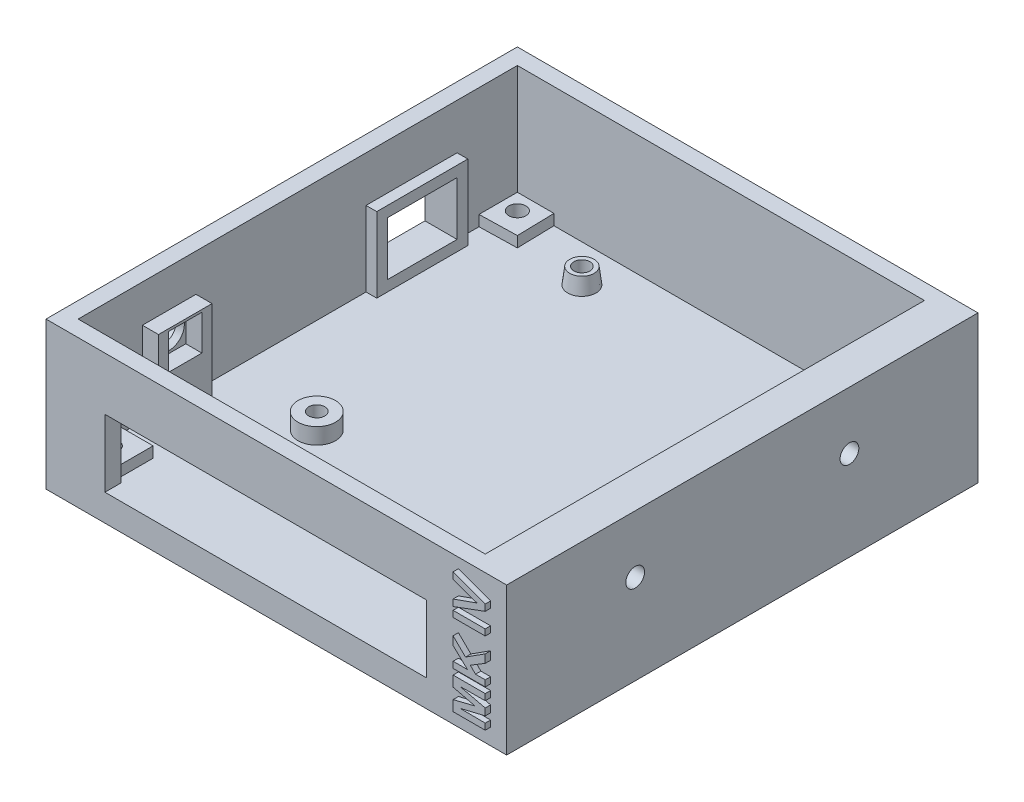
from build123d import *

# Parameters (mm, degrees)
SKETCH1_W            = 82
SKETCH1_H            = 88
BOSS_EXTRUDE1_DEPTH  = 5
SKETCH2_W            = 82
SKETCH2_H            = 88
SKETCH2_W_2          = 76
SKETCH2_H_2          = 82
BOSS_EXTRUDE2_DEPTH  = 22.5
SKETCH_1_R           = 3.5
SKETCH_1_R_2         = 1.5
BOSS_EXTRUDE3_DEPTH  = 3
SKETCH4_W            = 13
SKETCH4_H            = 12
CUT_EXTRUDE1_DEPTH   = 3
SKETCH7_R            = 1.6
CUT_EXTRUDE3_DEPTH   = 67.130552697
CUT_EXTRUDE4_DEPTH   = 3.5
SKETCH10_W           = 17
SKETCH10_H           = 16
SKETCH10_W_2         = 13
SKETCH10_H_2         = 12
BOSS_EXTRUDE6_DEPTH  = 2
CHAMFER1_SIZE        = 10
CHAMFER1_SIZE_2      = 1.227845609
SKETCH11_R           = 1.5
CUT_EXTRUDE5_DEPTH   = 65.212537717
SKETCH12_W           = 60
SKETCH12_H           = 12.6
CUT_EXTRUDE6_DEPTH   = 3
SKETCH13_R           = 1.75
CUT_EXTRUDE7_DEPTH   = 3
BOSS_EXTRUDE7_START  = 4
SKETCH14_W           = 88
SKETCH14_H           = 27.5
SKETCH14_R           = 1.75
BOSS_EXTRUDE7_DEPTH  = 4
SKETCH15_R           = 3.75
CUT_EXTRUDE8_DEPTH   = 3
CUT_EXTRUDE9_REACH   = 102.44
SKETCH16_R           = 2.25
SKETCH17_W           = 10
SKETCH17_H           = 15.5
SKETCH17_W_2         = 6.2
SKETCH17_H_2         = 6.6
BOSS_EXTRUDE8_DEPTH  = 3
CHAMFER2_SIZE        = 1
CHAMFER2_SIZE2       = 0.577350269
SKETCH20_R           = 5
SKETCH20_R_2         = 3
BOSS_EXTRUDE10_DEPTH = 1
FILLET3_R            = 2
SKETCH21_W           = 5
SKETCH21_H           = 13
BOSS_EXTRUDE11_DEPTH = 2
SKETCH22_W           = 6
SKETCH22_H           = 1.153846154
BOSS_EXTRUDE12_DEPTH = 1
SKETCH23_W           = 7
SKETCH23_H           = 7
SKETCH23_R           = 1.6
BOSS_EXTRUDE13_DEPTH = 2
SKETCH25_W           = 17
SKETCH25_H           = 14
SKETCH25_W_2         = 13
SKETCH25_H_2         = 10
BOSS_EXTRUDE15_DEPTH = 1
FILLET4_R            = 2


with BuildPart() as part:
    # Sketch1 → Boss-Extrude1 (new body)
    with BuildSketch(Plane(origin=(0, 0, 0), x_dir=(1, 0, 0), z_dir=(0, 1, 0))):
        Rectangle(SKETCH1_W, SKETCH1_H)
    extrude(amount=BOSS_EXTRUDE1_DEPTH)

    # Sketch2 → Boss-Extrude2 (add)
    with BuildSketch(Plane(origin=(0, 5, 0), x_dir=(1, 0, 0), z_dir=(0, 1, 0))):
        Rectangle(SKETCH2_W, SKETCH2_H)
        Rectangle(SKETCH2_W_2, SKETCH2_H_2, mode=Mode.SUBTRACT)
    extrude(amount=BOSS_EXTRUDE2_DEPTH)

    # Эскиз1 → Boss-Extrude3 (add)
    # profile 1 of 4: a face of its own
    with BuildSketch(Plane(origin=(0, 5, 0), x_dir=(1, 0, 0), z_dir=(0, 1, 0))):
        with Locations(Location((-20.3, -14.15, 0), (0, 0, 90))):
            Circle(SKETCH_1_R)
        with Locations(Location((-20.3, -14.15, 0), (0, 0, 270))):
            Circle(SKETCH_1_R_2, mode=Mode.SUBTRACT)
    # profile 2 of 4: a face of its own
    with BuildSketch(Plane(origin=(0, 5, 0), x_dir=(1, 0, 0), z_dir=(0, 1, 0))):
        with Locations(Location((-19, 34.05, 0), (0, 0, 90))):
            Circle(SKETCH_1_R)
        with Locations(Location((-19, 34.05, 0), (0, 0, 270))):
            Circle(SKETCH_1_R_2, mode=Mode.SUBTRACT)
    # profile 3 of 4: a face of its own
    with BuildSketch(Plane(origin=(0, 5, 0), x_dir=(1, 0, 0), z_dir=(0, 1, 0))):
        with Locations(Location((31.8, 18.85, 0), (0, 0, 90))):
            Circle(SKETCH_1_R)
        with Locations(Location((31.8, 18.85, 0), (0, 0, 270))):
            Circle(SKETCH_1_R_2, mode=Mode.SUBTRACT)
    # profile 4 of 4: a face of its own
    with BuildSketch(Plane(origin=(0, 5, 0), x_dir=(1, 0, 0), z_dir=(0, 1, 0))):
        with Locations(Location((31.8, -9.05, 0), (0, 0, 90))):
            Circle(SKETCH_1_R)
        with Locations(Location((31.8, -9.05, 0), (0, 0, 270))):
            Circle(SKETCH_1_R_2, mode=Mode.SUBTRACT)
    extrude(amount=BOSS_EXTRUDE3_DEPTH)

    # Sketch4 → Cut-Extrude1 (cut)
    with BuildSketch(Plane.ZY.offset(41)):
        with Locations((-21.25, 11)):
            Rectangle(SKETCH4_W, SKETCH4_H)
    extrude(amount=-CUT_EXTRUDE1_DEPTH, mode=Mode.SUBTRACT)

    # Sketch7 → Cut-Extrude3 (cut, through all)
    with BuildSketch(Plane.XZ):
        with Locations(Location((35, -38, 0), (0, 0, 270))):
            Circle(SKETCH7_R)
        with Locations(Location((-35, -38, 0), (0, 0, 270))):
            Circle(SKETCH7_R)
        with Locations(Location((-35, 38, 0), (0, 0, 270))):
            Circle(SKETCH7_R)
        with Locations(Location((35, 38, 0), (0, 0, 270))):
            Circle(SKETCH7_R)
    extrude(amount=-CUT_EXTRUDE3_DEPTH, mode=Mode.SUBTRACT)

    # Sketch8 → Cut-Extrude4 (cut)
    with BuildSketch(Plane.XZ):
        Polygon((33.375, 35.185417438), (36.625, 35.185417438), (38.25, 38), (36.625, 40.814582562), (33.375, 40.814582562), (31.75, 38), align=None)
        Polygon((33.375, -35.185417438), (31.75, -38), (33.375, -40.814582562), (36.625, -40.814582562), (38.25, -38), (36.625, -35.185417438), align=None)
        Polygon((-36.625, -35.185417438), (-38.25, -38), (-36.625, -40.814582562), (-33.375, -40.814582562), (-31.75, -38), (-33.375, -35.185417438), align=None)
        Polygon((-36.625, 35.185417438), (-33.375, 35.185417438), (-31.75, 38), (-33.375, 40.814582562), (-36.625, 40.814582562), (-38.25, 38), align=None)
    extrude(amount=-CUT_EXTRUDE4_DEPTH, mode=Mode.SUBTRACT)

    # Sketch10 → Boss-Extrude6 (add)
    with BuildSketch(Plane(origin=(-38, 0, 0), x_dir=(0, 0, -1), z_dir=(1, 0, 0))):
        with Locations((21.25, 11)):
            Rectangle(SKETCH10_W, SKETCH10_H)
        with Locations((21.25, 11)):
            Rectangle(SKETCH10_W_2, SKETCH10_H_2, mode=Mode.SUBTRACT)
    extrude(amount=BOSS_EXTRUDE6_DEPTH)

    # Chamfer1
    # the kernel refuses this chamfer: 10, 1.227845609 mm, written as the material it takes off along each edge
    with BuildSketch(Plane(origin=(-19, 8, -34.05), x_dir=(0, 0, -1), z_dir=(1, 0, 0))) as chamfer1_piece_1_section:
        Polygon((3.5, -CHAMFER1_SIZE), (3.5 - CHAMFER1_SIZE_2, 0), (3.5, 0), align=None)
    chamfer1_piece_1 = revolve(axis=Axis((-19, 8, -34.05), (0, 1, 0)), mode=Mode.PRIVATE)
    chamfer1_piece_1 = split(chamfer1_piece_1, bisect_by=Plane(origin=(-19, 5, -31.575672909), z_dir=(0, 1, 0)), keep=Keep.TOP, mode=Mode.PRIVATE)
    add(chamfer1_piece_1, mode=Mode.SUBTRACT)

    # Sketch11 → Cut-Extrude5 (cut, through all)
    with BuildSketch(Plane(origin=(0, 5, 0), x_dir=(1, 0, 0), z_dir=(0, 1, 0))):
        with Locations(Location((-20.3, -14.15, 0), (0, 0, 270))):
            Circle(SKETCH11_R)
        with Locations(Location((-19, 34.05, 0), (0, 0, 270))):
            Circle(SKETCH11_R)
        with Locations(Location((31.8, -9.05, 0), (0, 0, 270))):
            Circle(SKETCH11_R)
        with Locations(Location((31.8, 18.85, 0), (0, 0, 270))):
            Circle(SKETCH11_R)
    extrude(amount=-CUT_EXTRUDE5_DEPTH, mode=Mode.SUBTRACT)

    # Sketch12 → Cut-Extrude6 (cut)
    with BuildSketch(Plane.XY.offset(44)):
        with Locations((0, 11.3)):
            Rectangle(SKETCH12_W, SKETCH12_H)
    extrude(amount=-CUT_EXTRUDE6_DEPTH, mode=Mode.SUBTRACT)

    # Sketch13 → Cut-Extrude7 (cut)
    with BuildSketch(Plane(origin=(41, 0, 0), x_dir=(0, 0, -1), z_dir=(1, 0, 0))):
        with Locations((-20, 16.75)):
            Circle(SKETCH13_R)
        with Locations((20, 16.75)):
            Circle(SKETCH13_R)
    extrude(amount=-CUT_EXTRUDE7_DEPTH, mode=Mode.SUBTRACT)

    # Sketch14 → Boss-Extrude7 (add)
    with BuildSketch(Plane(origin=(41, 0, 0), x_dir=(0, 0, -1), z_dir=(1, 0, 0)).offset(BOSS_EXTRUDE7_START)):
        with Locations((0, 13.75)):
            Rectangle(SKETCH14_W, SKETCH14_H)
        with Locations((-20, 16.75)):
            Circle(SKETCH14_R, mode=Mode.SUBTRACT)
        with Locations((20, 16.75)):
            Circle(SKETCH14_R, mode=Mode.SUBTRACT)
    extrude(amount=-BOSS_EXTRUDE7_DEPTH)

    # Sketch15 → Cut-Extrude8 (cut)
    with BuildSketch(Plane.ZY.offset(-38)):
        with Locations((20, 16.75)):
            Circle(SKETCH15_R)
        with Locations((-20, 16.75)):
            Circle(SKETCH15_R)
    extrude(amount=-CUT_EXTRUDE8_DEPTH, mode=Mode.SUBTRACT)

    # Sketch16 → Cut-Extrude9 (cut, up to next)
    with BuildSketch(Plane.ZY.offset(41), mode=Mode.PRIVATE) as cut_extrude9_sk1:
        with Locations((24, 16.75)):
            Circle(SKETCH16_R)
    cut_extrude9_tool1 = extrude(cut_extrude9_sk1.sketch, amount=-CUT_EXTRUDE9_REACH, mode=Mode.PRIVATE) & part.part
    add(cut_extrude9_tool1.solids().sort_by_distance((-41, 16.75, 24))[0], mode=Mode.SUBTRACT)

    # Sketch17 → Boss-Extrude8 (add)
    with BuildSketch(Plane(origin=(-38, 0, 0), x_dir=(0, 0, -1), z_dir=(1, 0, 0))):
        with Locations((-24, 12.75)):
            Rectangle(SKETCH17_W, SKETCH17_H)
        with Locations((-24, 16.75)):
            Rectangle(SKETCH17_W_2, SKETCH17_H_2, mode=Mode.SUBTRACT)
    extrude(amount=BOSS_EXTRUDE8_DEPTH)

    # Chamfer2
    chamfer2_edges = [part.edges().sort_by_distance(p)[0] for p in [
        (-38, 16.75, 21.75),
    ]]
    chamfer2_side = [part.faces().sort_by_distance(p)[0] for p in [
        (-39.5, 16.75, 21.75),
    ]]
    chamfer(chamfer2_edges, length=CHAMFER2_SIZE, length2=CHAMFER2_SIZE2, reference=chamfer2_side[0])

    # Sketch20 → Boss-Extrude10 (add)
    with BuildSketch(Plane.ZY.offset(41)):
        with Locations(Location((24, 16.75, 0), (0, 0, 180))):
            Circle(SKETCH20_R)
        with Locations((24, 16.75)):
            Circle(SKETCH20_R_2, mode=Mode.SUBTRACT)
    extrude(amount=BOSS_EXTRUDE10_DEPTH)

    # Fillet3
    # the kernel refuses this fillet: 2 mm, written as the material it adds along each edge
    with BuildSketch(Plane(origin=(-41, 16.75, 24), x_dir=(0, 0, -1), z_dir=(0, 1, 0))) as fillet3_piece_1:
        with BuildLine():
            CenterArc((6.732050808, 2), FILLET3_R, 210, 60)
            Line((6.732050808, 0), (6.732050808, -0.04))
            Line((6.732050808, -0.04), (5, -0.04))
            Line((5, -0.04), (4.96, 0))
            ThreePointArc((4.96, 0), (4.96, 0.5), (4.965358984, 0.98))
            Line((4.965358984, 0.98), (5, 1))
        make_face()
    revolve(axis=Axis((-41, 16.75, 24), (-1, 0, 0)))

    # Sketch21 → Boss-Extrude11 (add)
    with BuildSketch(Plane(origin=(0, 5, 0), x_dir=(1, 0, 0), z_dir=(0, 1, 0))):
        with Locations((-38.5, 21.25)):
            Rectangle(SKETCH21_W, SKETCH21_H)
    extrude(amount=BOSS_EXTRUDE11_DEPTH)

    # Sketch22 → Boss-Extrude12 (add)
    with BuildSketch(Plane.XY.offset(44)):
        Polygon((42, 3.019230769), (36, 3.019230769), (36, 4.971153846), (40.092548077, 5.980769231), (36, 6.990384615), (36, 8.942307692), (42, 8.942307692), (42, 7.788461538), (37.276442308, 7.75), (42, 6.623798077), (42, 5.337740385), (37.276442308, 4.211538462), (42, 4.173076923), align=None)
        Polygon((42, 10.019230769), (36, 10.019230769), (36, 11.173076923), (38.686298077, 11.173076923), (36, 13.703125), (36, 15.288461538), (38.319711538, 13.009615385), (42, 15.365384615), (42, 13.828125), (39.212740385, 12.134615385), (40.191105769, 11.173076923), (42, 11.173076923), align=None)
        with Locations((39, 18.826923077)):
            Rectangle(SKETCH22_W, SKETCH22_H)
        Polygon((42, 22.237980769), (36, 20.019230769), (36, 21.237980769), (40.461538462, 22.826923077), (36, 24.409855769), (36, 25.634615385), (42, 23.424278846), align=None)
    extrude(amount=BOSS_EXTRUDE12_DEPTH)

    # Sketch23 → Boss-Extrude13 (add)
    # profile 1 of 4: a face of its own
    with BuildSketch(Plane(origin=(0, 5, 0), x_dir=(1, 0, 0), z_dir=(0, 1, 0))):
        with Locations((-34.5, -37.5)):
            Rectangle(SKETCH23_W, SKETCH23_H)
        with Locations(Location((-35, -38, 0), (0, 0, 90))):
            Circle(SKETCH23_R, mode=Mode.SUBTRACT)
    # profile 2 of 4: a face of its own
    with BuildSketch(Plane(origin=(0, 5, 0), x_dir=(1, 0, 0), z_dir=(0, 1, 0))):
        with Locations((34.5, -37.5)):
            Rectangle(SKETCH23_W, SKETCH23_H)
        with Locations(Location((35, -38, 0), (0, 0, 90))):
            Circle(SKETCH23_R, mode=Mode.SUBTRACT)
    # profile 3 of 4: a face of its own
    with BuildSketch(Plane(origin=(0, 5, 0), x_dir=(1, 0, 0), z_dir=(0, 1, 0))):
        with Locations((34.5, 37.5)):
            Rectangle(SKETCH23_W, SKETCH23_H)
        with Locations(Location((35, 38, 0), (0, 0, 90))):
            Circle(SKETCH23_R, mode=Mode.SUBTRACT)
    # profile 4 of 4: a face of its own
    with BuildSketch(Plane(origin=(0, 5, 0), x_dir=(1, 0, 0), z_dir=(0, 1, 0))):
        Polygon((-38, 33.837921002), (-31.001921416, 34.001921416), (-31.16592183, 41), (-38, 41), align=None)
        with Locations(Location((-35, 38, 0), (0, 0, 90))):
            Circle(SKETCH23_R, mode=Mode.SUBTRACT)
    extrude(amount=BOSS_EXTRUDE13_DEPTH)

    # Sketch25 → Boss-Extrude15 (add)
    with BuildSketch(Plane.ZY.offset(41)):
        with Locations((-21.25, 12)):
            Rectangle(SKETCH25_W, SKETCH25_H)
        with Locations((-21.25, 12)):
            Rectangle(SKETCH25_W_2, SKETCH25_H_2, mode=Mode.SUBTRACT)
    extrude(amount=BOSS_EXTRUDE15_DEPTH)

    # Fillet4
    # the kernel refuses this fillet: 2 mm, written as the material it adds along each edge
    with BuildSketch(Plane(origin=(-41, 19, -29.75), x_dir=(0, 1, 0), z_dir=(0, 0, 1)), Plane(origin=(-41, 5, -12.75), x_dir=(0, -1, 0), z_dir=(0, 0, -1))) as fillet4_piece_1:
        with BuildLine():
            CenterArc((1.732050808, 2), FILLET4_R, 210, 60)
            Line((0, 1), (-0.034641016, 0.98))
            ThreePointArc((-0.034641016, 0.98), (-0.04, 0.5), (-0.04, 0))
            Line((-0.04, 0), (0, -0.04))
            Line((0, -0.04), (1.732050808, -0.04))
            Line((1.732050808, -0.04), (1.732050808, 0))
        make_face()
    extrude(amount=17)
    with BuildSketch(Plane(origin=(-41, 5, -29.75), x_dir=(0, 0, -1), z_dir=(0, 1, 0)), Plane(origin=(-41, 19, -12.75), x_dir=(0, 0, 1), z_dir=(0, -1, 0))) as fillet4_piece_2:
        with BuildLine():
            CenterArc((1.732050808, 2), FILLET4_R, 210, 60)
            Line((0, 1), (-0.034641016, 0.98))
            ThreePointArc((-0.034641016, 0.98), (-0.04, 0.5), (-0.04, 0))
            Line((-0.04, 0), (0, -0.04))
            Line((0, -0.04), (1.732050808, -0.04))
            Line((1.732050808, -0.04), (1.732050808, 0))
        make_face()
    extrude(amount=14)
    with BuildSketch(Plane(origin=(-41, 5, -29.75), x_dir=(0, 0, -1), z_dir=(0, 1, 0))) as fillet4_piece_3a_section:
        with BuildLine():
            CenterArc((1.732050808, 2), FILLET4_R, 210, 60)
            Line((0, 1), (-0.034641016, 0.98))
            ThreePointArc((-0.034641016, 0.98), (-0.04, 0.5), (-0.04, 0))
            Line((-0.04, 0), (0, -0.04))
            Line((0, -0.04), (1.732050808, -0.04))
            Line((1.732050808, -0.04), (1.732050808, 0))
        make_face()
    fillet4_piece_3a = extrude(amount=18.330127019, mode=Mode.PRIVATE)
    fillet4_piece_3a = split(fillet4_piece_3a, bisect_by=Plane(origin=(-41.259033422, 19, -30.182620892), z_dir=(0, 1, 0)), keep=Keep.TOP, mode=Mode.PRIVATE)
    with BuildSketch(Plane(origin=(-41, 19, -34.080127019), x_dir=(0, 1, 0), z_dir=(0, 0, 1))) as fillet4_piece_3b_section:
        with BuildLine():
            CenterArc((1.732050808, 2), FILLET4_R, 210, 60)
            Line((0, 1), (-0.034641016, 0.98))
            ThreePointArc((-0.034641016, 0.98), (-0.04, 0.5), (-0.04, 0))
            Line((-0.04, 0), (0, -0.04))
            Line((0, -0.04), (1.732050808, -0.04))
            Line((1.732050808, -0.04), (1.732050808, 0))
        make_face()
    fillet4_piece_3b = extrude(amount=21.330127019, mode=Mode.PRIVATE)
    fillet4_piece_3b = split(fillet4_piece_3b, bisect_by=Plane(origin=(-41.259033422, 19.432620892, -29.75), z_dir=(0, 0, -1)), keep=Keep.TOP, mode=Mode.PRIVATE)
    fillet4_piece_3 = fillet4_piece_3a & fillet4_piece_3b
    add(fillet4_piece_3)
    with BuildSketch(Plane(origin=(-41, 19, -29.75), x_dir=(0, 1, 0), z_dir=(0, 0, 1))) as fillet4_piece_4a_section:
        with BuildLine():
            CenterArc((1.732050808, 2), FILLET4_R, 210, 60)
            Line((0, 1), (-0.034641016, 0.98))
            ThreePointArc((-0.034641016, 0.98), (-0.04, 0.5), (-0.04, 0))
            Line((-0.04, 0), (0, -0.04))
            Line((0, -0.04), (1.732050808, -0.04))
            Line((1.732050808, -0.04), (1.732050808, 0))
        make_face()
    fillet4_piece_4a = extrude(amount=21.330127019, mode=Mode.PRIVATE)
    fillet4_piece_4a = split(fillet4_piece_4a, bisect_by=Plane(origin=(-41.259033422, 19.432620892, -12.75), z_dir=(0, 0, 1)), keep=Keep.TOP, mode=Mode.PRIVATE)
    with BuildSketch(Plane(origin=(-41, 23.330127019, -12.75), x_dir=(0, 0, 1), z_dir=(0, -1, 0))) as fillet4_piece_4b_section:
        with BuildLine():
            CenterArc((1.732050808, 2), FILLET4_R, 210, 60)
            Line((0, 1), (-0.034641016, 0.98))
            ThreePointArc((-0.034641016, 0.98), (-0.04, 0.5), (-0.04, 0))
            Line((-0.04, 0), (0, -0.04))
            Line((0, -0.04), (1.732050808, -0.04))
            Line((1.732050808, -0.04), (1.732050808, 0))
        make_face()
    fillet4_piece_4b = extrude(amount=18.330127019, mode=Mode.PRIVATE)
    fillet4_piece_4b = split(fillet4_piece_4b, bisect_by=Plane(origin=(-41.259033422, 19, -12.317379108), z_dir=(0, 1, 0)), keep=Keep.TOP, mode=Mode.PRIVATE)
    fillet4_piece_4 = fillet4_piece_4a & fillet4_piece_4b
    add(fillet4_piece_4)
    with BuildSketch(Plane(origin=(-41, 5, -12.75), x_dir=(0, -1, 0), z_dir=(0, 0, -1))) as fillet4_piece_5a_section:
        with BuildLine():
            CenterArc((1.732050808, 2), FILLET4_R, 210, 60)
            Line((0, 1), (-0.034641016, 0.98))
            ThreePointArc((-0.034641016, 0.98), (-0.04, 0.5), (-0.04, 0))
            Line((-0.04, 0), (0, -0.04))
            Line((0, -0.04), (1.732050808, -0.04))
            Line((1.732050808, -0.04), (1.732050808, 0))
        make_face()
    fillet4_piece_5a = extrude(amount=21.330127019, mode=Mode.PRIVATE)
    fillet4_piece_5a = split(fillet4_piece_5a, bisect_by=Plane(origin=(-41.259033422, 4.567379108, -29.75), z_dir=(0, 0, -1)), keep=Keep.TOP, mode=Mode.PRIVATE)
    with BuildSketch(Plane(origin=(-41, 0.669872981, -29.75), x_dir=(0, 0, -1), z_dir=(0, 1, 0))) as fillet4_piece_5b_section:
        with BuildLine():
            CenterArc((1.732050808, 2), FILLET4_R, 210, 60)
            Line((0, 1), (-0.034641016, 0.98))
            ThreePointArc((-0.034641016, 0.98), (-0.04, 0.5), (-0.04, 0))
            Line((-0.04, 0), (0, -0.04))
            Line((0, -0.04), (1.732050808, -0.04))
            Line((1.732050808, -0.04), (1.732050808, 0))
        make_face()
    fillet4_piece_5b = extrude(amount=18.330127019, mode=Mode.PRIVATE)
    fillet4_piece_5b = split(fillet4_piece_5b, bisect_by=Plane(origin=(-41.259033422, 5, -30.182620892), z_dir=(0, -1, 0)), keep=Keep.TOP, mode=Mode.PRIVATE)
    fillet4_piece_5 = fillet4_piece_5a & fillet4_piece_5b
    add(fillet4_piece_5)
    with BuildSketch(Plane(origin=(-41, 5, -8.419872981), x_dir=(0, -1, 0), z_dir=(0, 0, -1))) as fillet4_piece_6a_section:
        with BuildLine():
            CenterArc((1.732050808, 2), FILLET4_R, 210, 60)
            Line((0, 1), (-0.034641016, 0.98))
            ThreePointArc((-0.034641016, 0.98), (-0.04, 0.5), (-0.04, 0))
            Line((-0.04, 0), (0, -0.04))
            Line((0, -0.04), (1.732050808, -0.04))
            Line((1.732050808, -0.04), (1.732050808, 0))
        make_face()
    fillet4_piece_6a = extrude(amount=21.330127019, mode=Mode.PRIVATE)
    fillet4_piece_6a = split(fillet4_piece_6a, bisect_by=Plane(origin=(-41.259033422, 4.567379108, -12.75), z_dir=(0, 0, 1)), keep=Keep.TOP, mode=Mode.PRIVATE)
    with BuildSketch(Plane(origin=(-41, 19, -12.75), x_dir=(0, 0, 1), z_dir=(0, -1, 0))) as fillet4_piece_6b_section:
        with BuildLine():
            CenterArc((1.732050808, 2), FILLET4_R, 210, 60)
            Line((0, 1), (-0.034641016, 0.98))
            ThreePointArc((-0.034641016, 0.98), (-0.04, 0.5), (-0.04, 0))
            Line((-0.04, 0), (0, -0.04))
            Line((0, -0.04), (1.732050808, -0.04))
            Line((1.732050808, -0.04), (1.732050808, 0))
        make_face()
    fillet4_piece_6b = extrude(amount=18.330127019, mode=Mode.PRIVATE)
    fillet4_piece_6b = split(fillet4_piece_6b, bisect_by=Plane(origin=(-41.259033422, 5, -12.317379108), z_dir=(0, -1, 0)), keep=Keep.TOP, mode=Mode.PRIVATE)
    fillet4_piece_6 = fillet4_piece_6a & fillet4_piece_6b
    add(fillet4_piece_6)


solid = part.part
